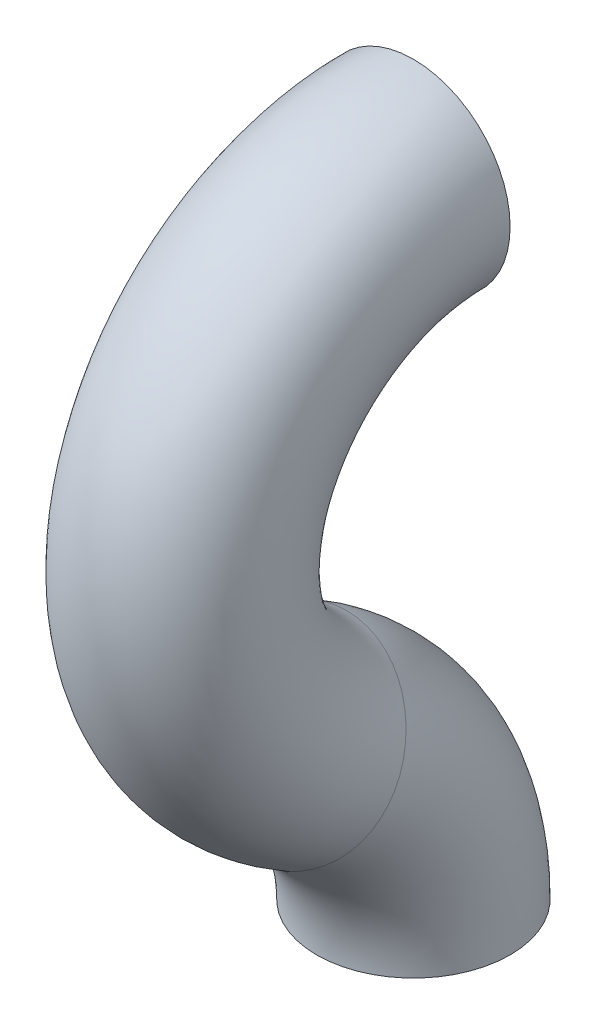
from build123d import *

# Parameters (mm, degrees)
SKETCH2_R = 23


with BuildPart() as part:
    # Sweep1: sweep along a path in Sketch1
    with BuildLine(Plane(origin=(0, 0, 0), x_dir=(0, 0, -1), z_dir=(1, 0, 0))) as sweep1_path:
        ThreePointArc((0, 0), (-7.355715851, 27.451905284), (-27.451905284, 47.548094716))
        ThreePointArc((-27.451905284, 47.548094716), (-53.033008589, 109.306341256), (0, 150))
    # Sketch2 → Sweep1 (sweep)
    with BuildSketch(Plane(origin=(0, 0, 0), x_dir=(1, 0, 0), z_dir=(0, 1, 0))):
        Circle(SKETCH2_R)
    sweep(path=sweep1_path.line)


solid = part.part
